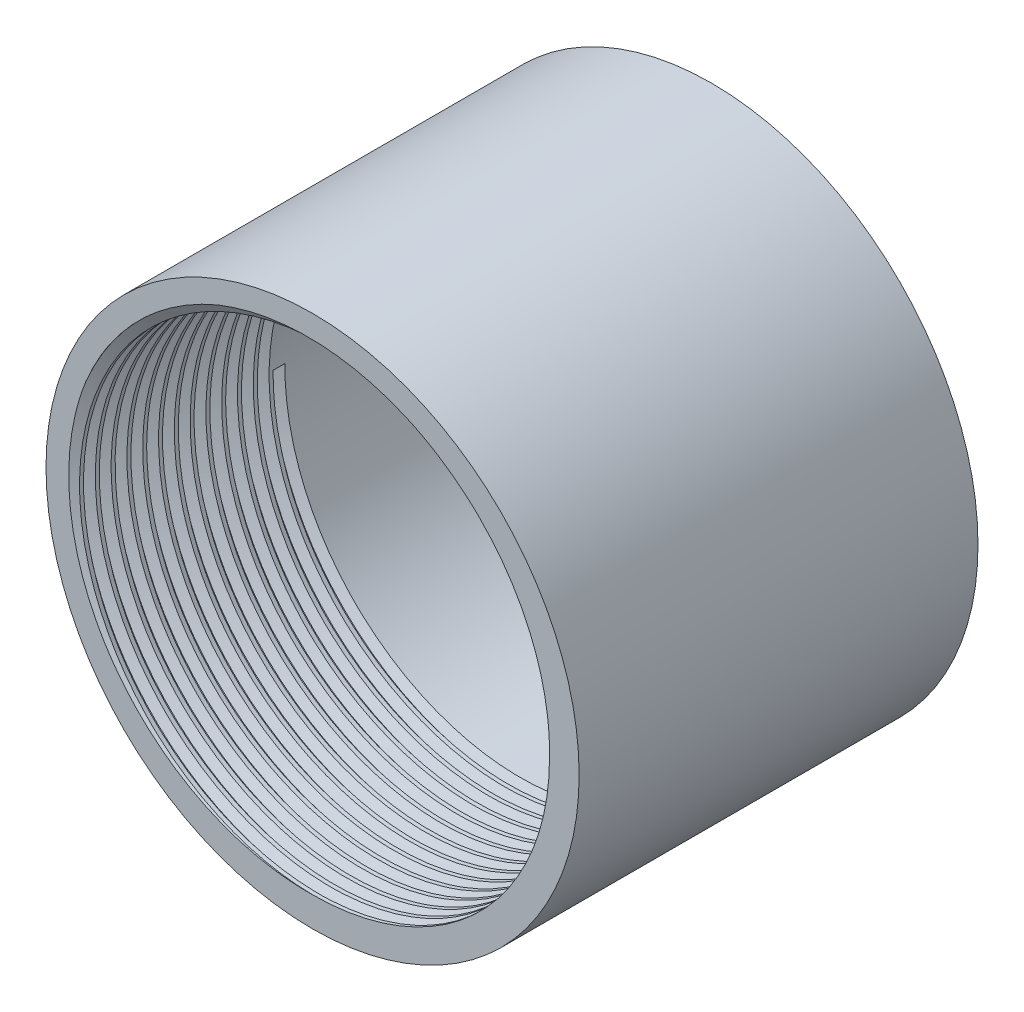
from build123d import *

# Parameters (mm, degrees)
ESQUISSE1_W     = 20.2
ESQUISSE1_H     = 1.5
FILETAGE2_PITCH = 0.8


with BuildPart() as part:
    # Esquisse1 → Révolution1 (revolve)
    with BuildSketch(Plane(origin=(0, 0, 0), x_dir=(0, 0, -1), z_dir=(1, 0, 0)), mode=Mode.PRIVATE) as r_volution1_sk:
        with Locations((0, 12.75)):
            Rectangle(ESQUISSE1_W, ESQUISSE1_H)
    revolve(r_volution1_sk.sketch.rotate(Axis((0, 0, 10.1), (0, 0, -1)), 90), axis=Axis((0, 0, 10.1), (0, 0, -1)))

    # Filetage2: the profile of Profil de filetage2 profile screwed along a right-hand helix of 15 turns, 8 arcs to a turn; built about Z, then put on its axis
    filetage2_z = Axis((0, 0, 0), (0, 0, 1))
    filetage2_corners = [(11.9997, 0, -0.000173205), (12.4330127, 0, 0.249999999), (12.4330127, 0, 0.349999999), (11.9997, 0, 0.600173203)]
    with BuildLine(mode=Mode.PRIVATE) as filetage2_profile:
        Line(filetage2_corners[0], filetage2_corners[1])
        Line(filetage2_corners[1], filetage2_corners[2])
        Line(filetage2_corners[2], filetage2_corners[3])
        Line(filetage2_corners[3], filetage2_corners[0])
    filetage2_cap = Face(filetage2_profile.wire())
    filetage2_turn_angles = [0, 22.5, 45, 67.5, 90, 112.5, 135, 157.5, 180, 202.5, 225, 247.5, 270, 292.5, 315, 337.5, 360]
    filetage2_turn_weights = [1, 0.9238795325112867, 1, 0.9238795325112867, 1, 0.9238795325112867, 1, 0.9238795325112867, 1, 0.9238795325112867, 1, 0.9238795325112867, 1, 0.9238795325112867, 1, 0.9238795325112867, 1]
    filetage2_turn_rails = [Edge.make_bspline([Vector(p[0], p[1], 0).rotate(filetage2_z, filetage2_turn_angles[k]) / filetage2_turn_weights[k] + Vector(0, 0, p[2] + FILETAGE2_PITCH * filetage2_turn_angles[k] / 360) for k in range(17)], [0, 0, 0, 1, 1, 2, 2, 3, 3, 4, 4, 5, 5, 6, 6, 7, 7, 8, 8, 8], 2, filetage2_turn_weights) for p in filetage2_corners]
    filetage2_turn_sides = [Face.make_surface_from_curves(filetage2_turn_rails[p[0]], filetage2_turn_rails[p[1]]) for p in [(0, 1), (1, 2), (2, 3), (3, 0)]]
    filetage2 = Plane(origin=(0, 0, 12.1), x_dir=(-1, 0, 0), z_dir=(0, 0, -1)) * Solid(Shell([*[p.moved(Location((0, 0, FILETAGE2_PITCH * i))) for i in range(15) for p in filetage2_turn_sides], filetage2_cap, filetage2_cap.rotate(filetage2_z, 5400).moved(Location((0, 0, FILETAGE2_PITCH * 5400 / 360)))]))
    add(filetage2, mode=Mode.SUBTRACT)


solid = part.part
